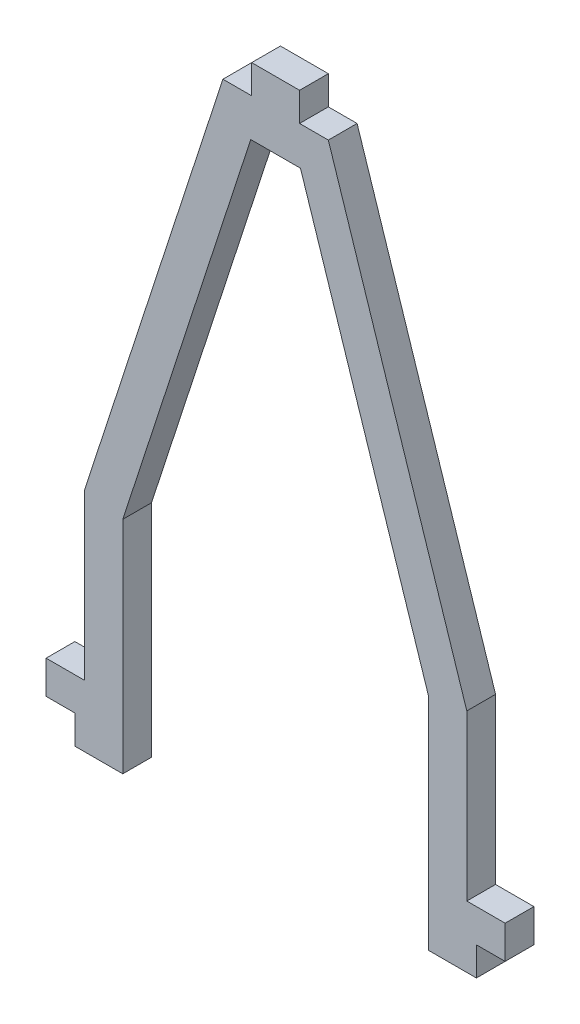
from build123d import *

# Parameters (mm, degrees)
BOSS_EXTRUDE1_DEPTH = 3


with BuildPart() as part:
    # Sketch1 → Boss-Extrude1 (new body)
    with BuildSketch(Plane.XY):
        Polygon((-6.383894407, -66.093441029), (-6.383894407, -43.093441029), (6.970100205, -2.093441029), (12.162110982, -2.093441029), (25.516105593, -43.093441029), (25.516105593, -66.093441029), (30.516105593, -66.093441029), (30.516105593, -63.093441029), (33.516105593, -63.093441029), (33.516105593, -59.638769888), (29.516105593, -59.638769888), (29.516105593, -42.458443205), (15.066105593, 1.906558971), (12.066105593, 1.906558971), (12.066105593, 4.906558971), (7.066105593, 4.906558971), (7.066105593, 1.906558971), (4.066105593, 1.906558971), (-10.383894407, -42.458443205), (-10.383894407, -59.638769888), (-14.383894407, -59.638769888), (-14.383894407, -63.093441029), (-11.383894407, -63.093441029), (-11.383894407, -66.093441029), align=None)
    extrude(amount=BOSS_EXTRUDE1_DEPTH)


solid = part.part
